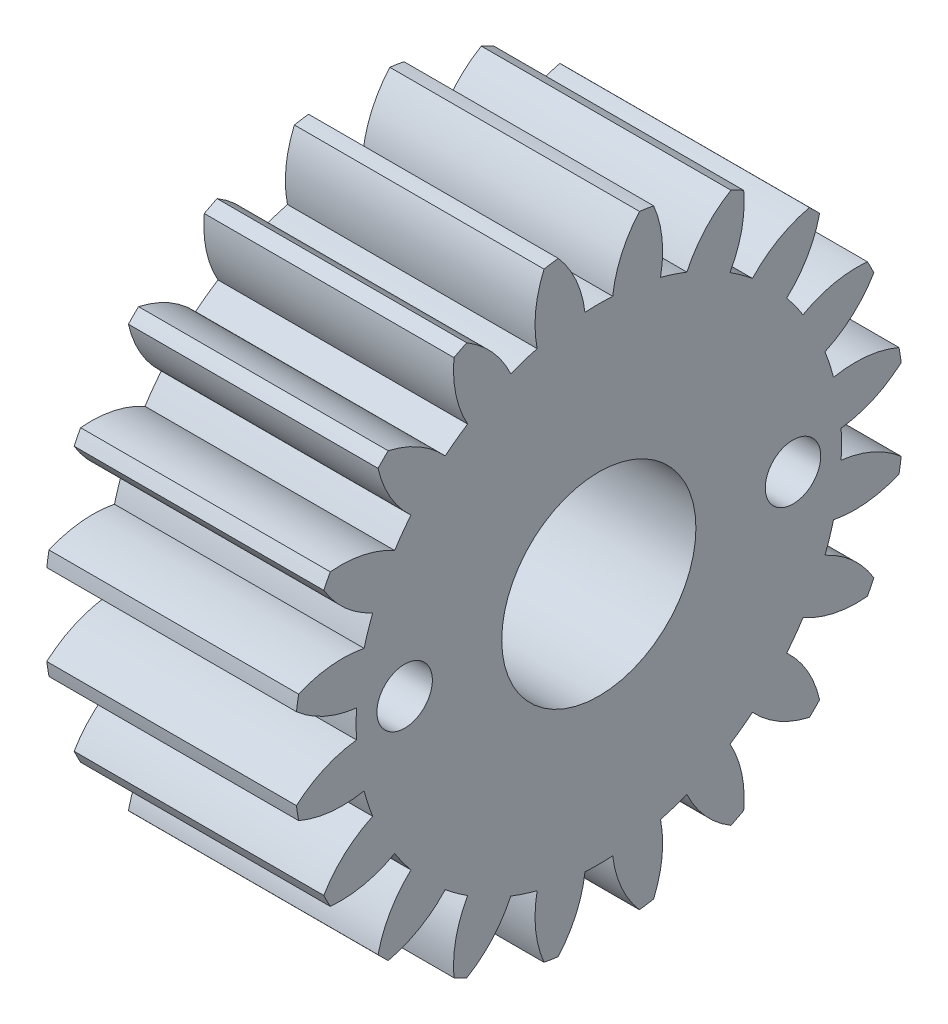
from build123d import *

# Parameters (mm, degrees)
BASPROSKE_W        = 9
BASPROSKE_H        = 11
TOOTHCUT_DEPTH     = 18.972200756
TEETHCUTS_COUNT    = 20
TEETHCUTS_ANGLE    = 342
BORSKE_R           = 3.5
BORE_DEPTH         = 50.0000508
SKETCH1_R          = 1
CUT_EXTRUDE1_DEPTH = 18.852389344


with BuildPart() as part:
    # BasProSke → Base-Revolve (revolve)
    with BuildSketch(Plane(origin=(0, 0, 0), x_dir=(1, 0, 0), z_dir=(0, 1, 0))):
        with Locations((4.5, 5.5)):
            Rectangle(BASPROSKE_W, BASPROSKE_H)
    revolve(axis=Axis((-10, 0, 0), (1, 0, 0)))

    # TooCutSke → ToothCut (cut, through all)
    with BuildSketch(Plane(origin=(0, 0, 0), x_dir=(0, 0, -1), z_dir=(1, 0, 0))):
        with BuildLine():
            ThreePointArc((0.499924007, 8.734705318), (0, 8.749), (-0.499924007, 8.734705318))
            ThreePointArc((-0.499924007, 8.734705318), (-0.824302243, 9.905497836), (-1.485192705, 10.924909509))
            ThreePointArc((-1.485192705, 10.924909509), (0, 11.0254), (1.485192705, 10.924909509))
            ThreePointArc((1.485192705, 10.924909509), (0.824302243, 9.905497836), (0.499924007, 8.734705318))
        make_face()
    toothcut = extrude(amount=TOOTHCUT_DEPTH, mode=Mode.SUBTRACT)

    # TeethCuts: ToothCut ×20 about axis
    teethcuts_axis = Axis((-10, 0, 0), (1, 0, 0))
    for i in range(1, TEETHCUTS_COUNT):
        add(toothcut.rotate(teethcuts_axis, i * TEETHCUTS_ANGLE / (TEETHCUTS_COUNT - 1)), mode=Mode.SUBTRACT)

    # BorSke → Bore (cut, symmetric)
    with BuildSketch(Plane(origin=(0, 0, 0), x_dir=(0, 0, -1), z_dir=(1, 0, 0))):
        Circle(BORSKE_R)
    extrude(amount=BORE_DEPTH, both=True, mode=Mode.SUBTRACT)

    # Sketch1 → Cut-Extrude1 (cut, through all)
    with BuildSketch(Plane(origin=(9, 0, 0), x_dir=(0, 0, -1), z_dir=(1, 0, 0))):
        with Locations((-7, 0)):
            Circle(SKETCH1_R)
        with Locations((7, 0)):
            Circle(SKETCH1_R)
    extrude(amount=-CUT_EXTRUDE1_DEPTH, mode=Mode.SUBTRACT)


solid = part.part
